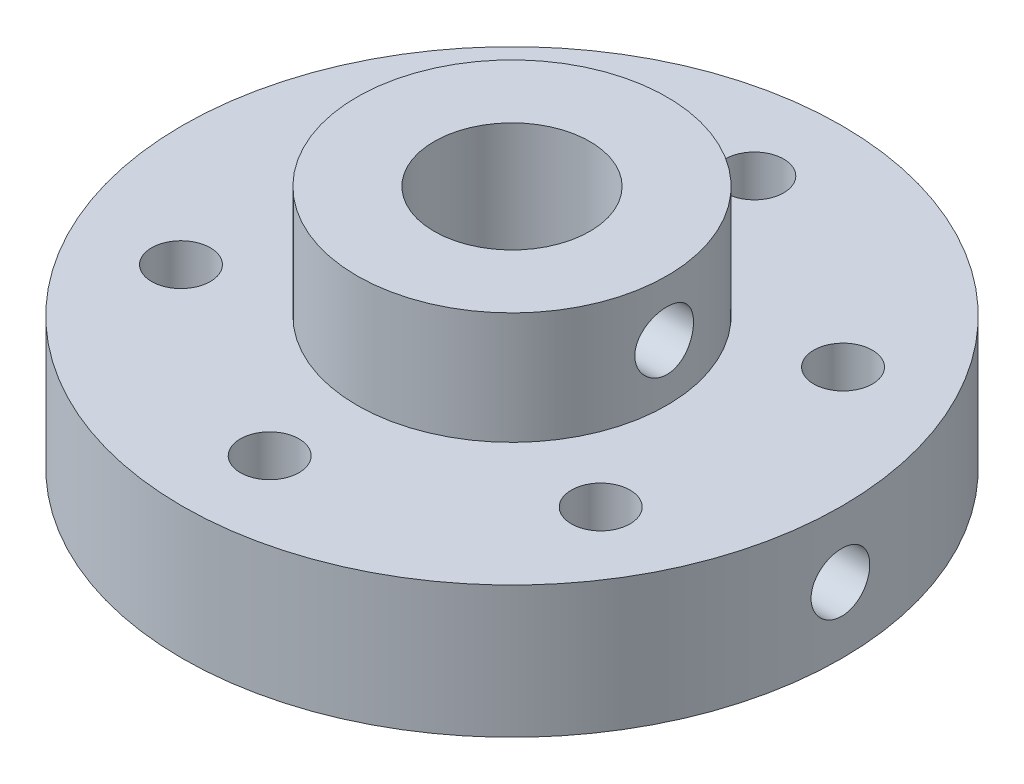
from build123d import *

# Parameters (mm, degrees)
SKETCH8_R                      = 12.7
BOSS_EXTRUDE6_DEPTH            = 5.08
SKETCH9_R                      = 5.969
BOSS_EXTRUDE7_DEPTH            = 4.318
F_4_40_TAPPED_HOLE1_D          = 2.2606
CIRPATTERN1_COUNT              = 6
SKETCH12_R                     = 3
CUT_EXTRUDE2_DEPTH             = 21.270727762
SKETCH13_W                     = 1.1303
SKETCH13_H                     = 12.7
F_4_40_TAPPED_HOLE2_AT_2_COUNT = 2
F_4_40_TAPPED_HOLE2_AT_2_PITCH = 4.699


with BuildPart() as part:
    # Sketch8 → Boss-Extrude6 (new body)
    with BuildSketch(Plane(origin=(0, 0, 0), x_dir=(1, 0, 0), z_dir=(0, 1, 0))):
        Circle(SKETCH8_R)
    extrude(amount=BOSS_EXTRUDE6_DEPTH)

    # Sketch9 → Boss-Extrude7 (add)
    with BuildSketch(Plane(origin=(0, 5.08, 0), x_dir=(1, 0, 0), z_dir=(0, 1, 0))):
        Circle(SKETCH9_R)
    extrude(amount=BOSS_EXTRUDE7_DEPTH)

    # #4-40 Tapped Hole1 (through all)
    with Locations(Plane(origin=(0, 5.08, 0), x_dir=(1, 0, 0), z_dir=(0, 1, 0))):
        with Locations((0, 9.3345)):
            f_4_40_tapped_hole1 = Hole(F_4_40_TAPPED_HOLE1_D / 2)

    # CirPattern1: #4-40 Tapped Hole1 ×6 about axis
    cirpattern1_axis = Axis((0, 9.398, 0), (0, -1, 0))
    for i in range(1, CIRPATTERN1_COUNT):
        add(f_4_40_tapped_hole1.rotate(cirpattern1_axis, i * 360 / CIRPATTERN1_COUNT), mode=Mode.SUBTRACT)

    # Sketch12 → Cut-Extrude2 (cut, through all)
    with BuildSketch(Plane(origin=(0, 9.398, 0), x_dir=(1, 0, 0), z_dir=(0, 1, 0))):
        Circle(SKETCH12_R)
    extrude(amount=-CUT_EXTRUDE2_DEPTH, mode=Mode.SUBTRACT)

    # Sketch13 → #4-40 Tapped Hole2 (revolve, cut)
    with BuildSketch(Plane.ZX.offset(7.239)):
        with Locations((0.56515, 6.35)):
            Rectangle(SKETCH13_W, SKETCH13_H)
    f_4_40_tapped_hole2 = revolve(axis=Axis((-6.35, 7.239, 0), (1, 0, 0)), mode=Mode.SUBTRACT)

    # #4-40 Tapped Hole2 at 2: #4-40 Tapped Hole2 ×2
    with Locations(*[(0, -i * F_4_40_TAPPED_HOLE2_AT_2_PITCH, 0) for i in range(1, F_4_40_TAPPED_HOLE2_AT_2_COUNT)]):
        add(f_4_40_tapped_hole2, mode=Mode.SUBTRACT)


solid = part.part
